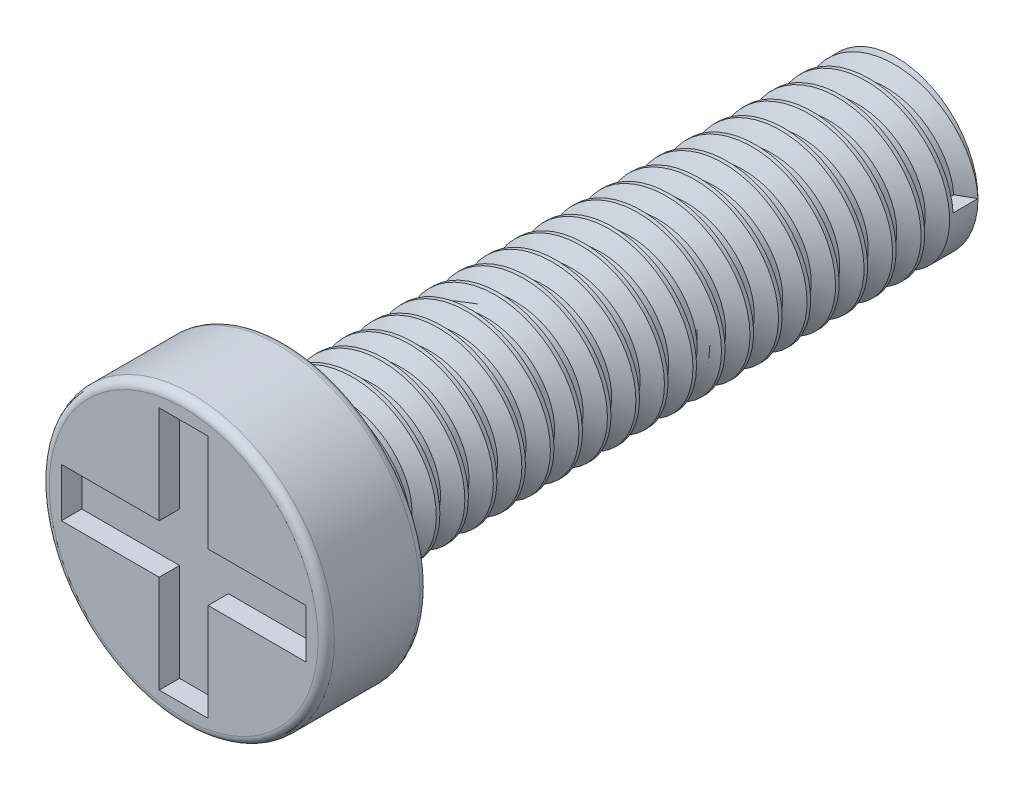
from build123d import *

# Parameters (mm, degrees)
SKETCH1_R           = 2
BOSS_EXTRUDE1_DEPTH = 15
SKETCH2_R           = 3.5
BOSS_EXTRUDE2_DEPTH = 2.5
SKETCH7_W           = 1.2
SKETCH7_H           = 2.4
SKETCH7_W_2         = 2.4
SKETCH7_H_2         = 1.2
CUT_EXTRUDE1_DEPTH  = 0.5
FILLET1_R           = 0.2
THREAD1_PITCH       = 0.7


with BuildPart() as part:
    # Sketch1 → Boss-Extrude1 (new body)
    with BuildSketch(Plane.XY):
        Circle(SKETCH1_R)
    extrude(amount=BOSS_EXTRUDE1_DEPTH)

    # Sketch2 → Boss-Extrude2 (add)
    with BuildSketch(Plane.XY.offset(15)):
        Circle(SKETCH2_R)
    extrude(amount=BOSS_EXTRUDE2_DEPTH)

    # Sketch7 → Cut-Extrude1 (cut)
    with BuildSketch(Plane.XY.offset(17.5)):
        with Locations((0, 1.8)):
            Rectangle(SKETCH7_W, SKETCH7_H)
        with Locations((1.8, 0)):
            Rectangle(SKETCH7_W_2, SKETCH7_H_2)
        with Locations((0, -1.8)):
            Rectangle(SKETCH7_W, SKETCH7_H)
        with Locations((-1.8, 0)):
            Rectangle(SKETCH7_W_2, SKETCH7_H_2)
        Rectangle(SKETCH7_W, SKETCH7_H_2)
    extrude(amount=-CUT_EXTRUDE1_DEPTH, mode=Mode.SUBTRACT)

    # Fillet1
    fillet1_edges = [part.edges().sort_by_distance(p)[0] for p in [
        (-3.5, 0, 15),
        (-3.5, 0, 17.5),
    ]]
    fillet(fillet1_edges, radius=FILLET1_R)

    # Thread1: arcs per turn and ends read off the stored shape
    # Thread1: the profile of Thread Profile1 profile screwed along a right-hand helix through 21.428571 turns, 6 arcs to a turn; built about Z, then put on its axis
    thread1_z = Axis((0, 0, 0), (0, 0, 1))
    thread1_corners = [(2.0003, 0, -0.000173205), (2.0003, 0, 0.612673203), (1.621113887, 0, 0.393749999), (1.621113887, 0, 0.218749999)]
    with BuildLine(mode=Mode.PRIVATE) as thread1_profile:
        Line(thread1_corners[0], thread1_corners[1])
        Line(thread1_corners[1], thread1_corners[2])
        Line(thread1_corners[2], thread1_corners[3])
        Line(thread1_corners[3], thread1_corners[0])
    thread1_cap = Face(thread1_profile.wire())
    thread1_turn_angles = [0, 30, 60, 90, 120, 150, 180, 210, 240, 270, 300, 330, 360]
    thread1_turn_weights = [1, 0.8660254037844387, 1, 0.8660254037844387, 1, 0.8660254037844387, 1, 0.8660254037844387, 1, 0.8660254037844387, 1, 0.8660254037844387, 1]
    thread1_turn_rails = [Edge.make_bspline([Vector(p[0], p[1], 0).rotate(thread1_z, thread1_turn_angles[k]) / thread1_turn_weights[k] + Vector(0, 0, p[2] + THREAD1_PITCH * thread1_turn_angles[k] / 360) for k in range(13)], [0, 0, 0, 1, 1, 2, 2, 3, 3, 4, 4, 5, 5, 6, 6, 6], 2, thread1_turn_weights) for p in thread1_corners]
    thread1_turn_sides = [Face.make_surface_from_curves(thread1_turn_rails[p[0]], thread1_turn_rails[p[1]]) for p in [(0, 1), (1, 2), (2, 3), (3, 0)]]
    thread1_last_angles = [7560, 7590, 7620, 7650, 7680, 7697.142857143, 7714.285714286]
    thread1_last_weights = [1, 0.8660254037844387, 1, 0.8660254037844387, 1, 0.9555728057861397, 1]
    thread1_last_rails = [Edge.make_bspline([Vector(p[0], p[1], 0).rotate(thread1_z, thread1_last_angles[k]) / thread1_last_weights[k] + Vector(0, 0, p[2] + THREAD1_PITCH * thread1_last_angles[k] / 360) for k in range(7)], [0, 0, 0, 1, 1, 2, 2, 3, 3, 3], 2, thread1_last_weights) for p in thread1_corners]
    thread1_last_sides = [Face.make_surface_from_curves(thread1_last_rails[p[0]], thread1_last_rails[p[1]]) for p in [(0, 1), (1, 2), (2, 3), (3, 0)]]
    thread1 = Plane(origin=(0, 0, 0), x_dir=(1, 0, 0), z_dir=(0, 0, 1)) * Solid(Shell([*[p.moved(Location((0, 0, THREAD1_PITCH * i))) for i in range(21) for p in thread1_turn_sides], *thread1_last_sides, thread1_cap, thread1_cap.rotate(thread1_z, 7714.285714286).moved(Location((0, 0, THREAD1_PITCH * 7714.285714286 / 360)))]))
    add(thread1, mode=Mode.SUBTRACT)


solid = part.part
